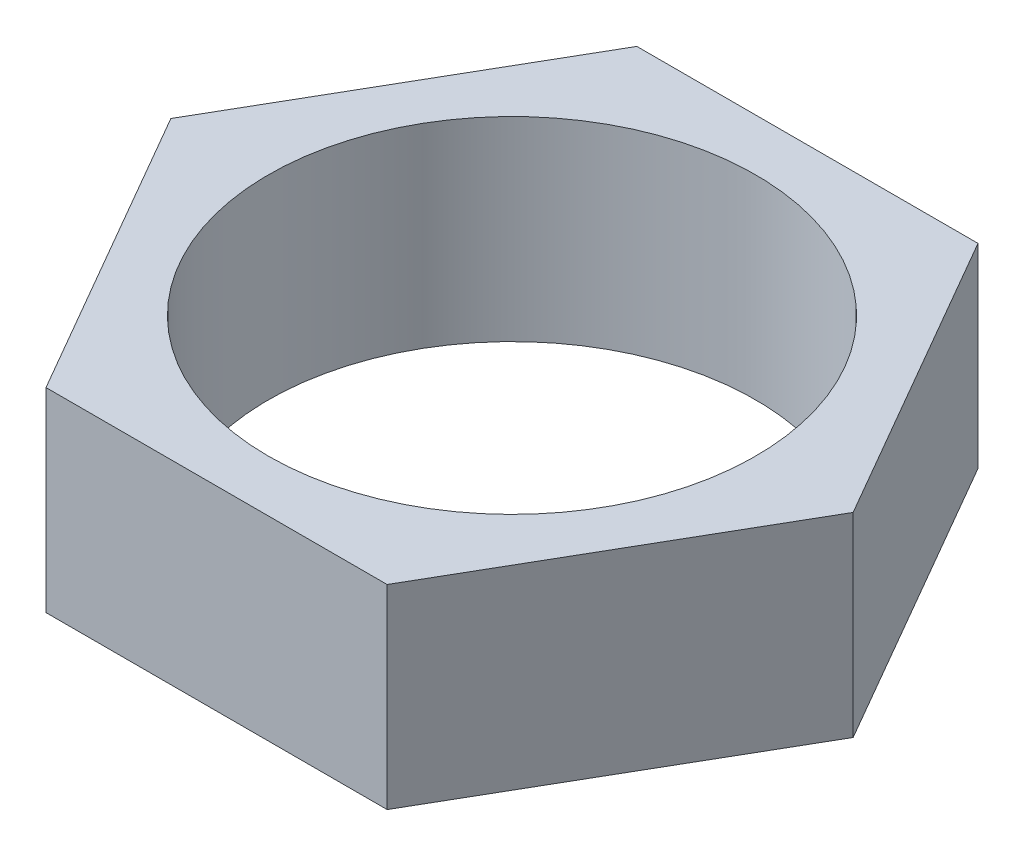
from build123d import *

# Parameters (mm, degrees)
SKETCH1_R           = 12.5
BOSS_EXTRUDE1_DEPTH = 10


with BuildPart() as part:
    # Sketch1 → Boss-Extrude1 (new body)
    with BuildSketch(Plane(origin=(0, 0, 0), x_dir=(1, 0, 0), z_dir=(0, 1, 0))):
        Polygon((-17.5, 0), (-8.75, -15.155444566), (8.75, -15.155444566), (17.5, 0), (8.75, 15.155444566), (-8.75, 15.155444566), align=None)
        Circle(SKETCH1_R, mode=Mode.SUBTRACT)
    extrude(amount=BOSS_EXTRUDE1_DEPTH)


solid = part.part
